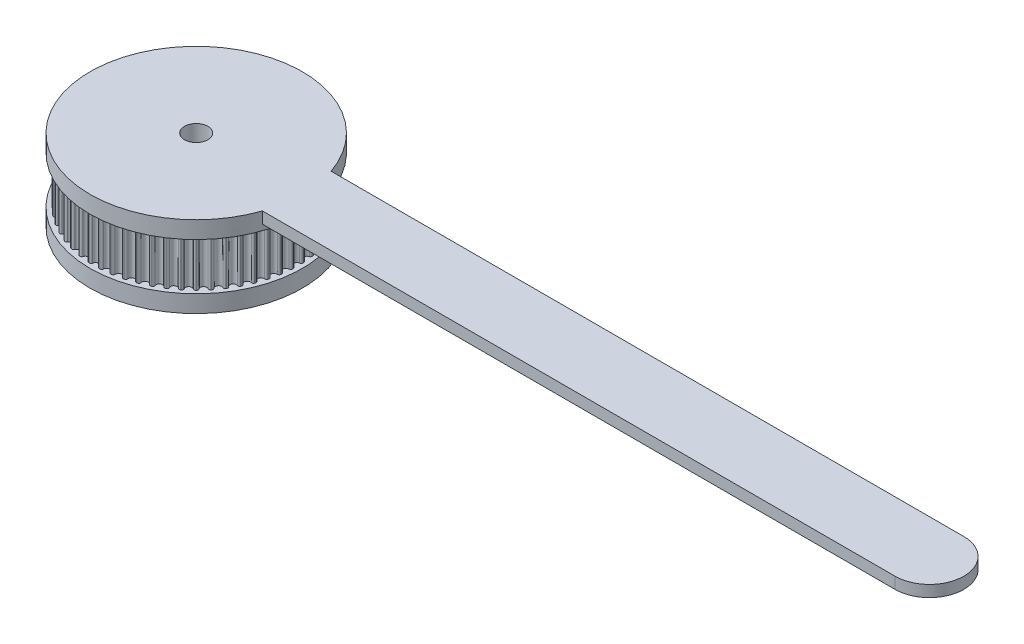
from build123d import *
from build123d.topology import SkipClean

# Parameters (mm, degrees)
BOSS_EXTRUDE1_DEPTH     = 6.499999954
CIRPATTERN1_COUNT       = 60
SKETCH2_W               = 29.441486473
SKETCH2_H               = 1.5875
BOSS_EXTRUDE4_DEPTH     = 3.175
BOSS_EXTRUDE5_START     = 3.175
SKETCH8_R               = 29.441486473
BOSS_EXTRUDE5_DEPTH     = 3.175
CUT_EXTRUDE1_DEPTH      = 216.930781436
CUT_EXTRUDE1_DEPTH_BACK = 216.930781436
SKETCH9_R               = 3.2385


with BuildPart() as part:
    # Sketch1 → Boss-Extrude1 (new, symmetric)
    with BuildSketch(Plane(origin=(0, 0, 0), x_dir=(1, 0, 0), z_dir=(0, 1, 0))):
        with BuildLine():
            ThreePointArc((0, 27.046736373), (0.58129755, 27.262797831), (0.880356905, 27.806077591))
            ThreePointArc((0.880356905, 27.806077591), (1.057844919, 28.119262803), (1.399698205, 28.232060424))
            ThreePointArc((1.399698205, 28.232060424), (1.479366683, 28.227997893), (1.55902338, 28.223710545))
            ThreePointArc((1.55902338, 28.223710545), (1.887213395, 28.075797443), (2.030992343, 27.745775343))
            ThreePointArc((2.030992343, 27.745775343), (2.271625221, 27.174211512), (2.827153789, 26.898571521))
            ThreePointArc((2.827153789, 26.898571521), (-1.415516811, -27.009669761), (0, 27.046736373))
        make_face()
    boss_extrude1 = extrude(amount=BOSS_EXTRUDE1_DEPTH, both=True)

    # CirPattern1: Boss-Extrude1 ×60 about axis
    cirpattern1_axis = Axis((0, 0, 0), (0, 1, 0))
    for i in range(1, CIRPATTERN1_COUNT):
        add(boss_extrude1.rotate(cirpattern1_axis, i * 360 / CIRPATTERN1_COUNT))

    # Sketch2 → Revolve3 (revolve)
    with BuildSketch(Plane(origin=(0, 0, 0), x_dir=(0, 0, -1), z_dir=(1, 0, 0)), mode=Mode.PRIVATE) as revolve3_sk:
        with Locations((14.720743237, 7.293749954)):
            Rectangle(SKETCH2_W, SKETCH2_H)
    revolve3 = revolve(revolve3_sk.sketch.rotate(Axis((0, 3.3, 0), (0, -1, 0)), 180), axis=Axis((0, 3.3, 0), (0, -1, 0)))

    # Mirror1: Revolve3 across plane
    add(revolve3.mirror(Plane.ZX))

    # Sketch7 → Boss-Extrude4 (add)
    with SkipClean():  # the faces are left unmerged after this step: merging them gives an invalid solid
        with BuildSketch(Plane(origin=(0, 8.087499954, 0), x_dir=(1, 0, 0), z_dir=(0, 1, 0))):
            with BuildLine():
                Line((27.858131681, 9.525), (203.2, 9.525))
                ThreePointArc((203.2, 9.525), (212.725, 0), (203.2, -9.525))
                Line((203.2, -9.525), (27.858131681, -9.525))
                ThreePointArc((27.858131681, -9.525), (-29.441486473, 0), (27.858131681, 9.525))
            make_face()
        extrude(amount=BOSS_EXTRUDE4_DEPTH)

    # Sketch8 → Boss-Extrude5 (add)
    with SkipClean():  # the faces are left unmerged after this step: merging them gives an invalid solid
        with BuildSketch(Plane.XZ.offset(8.087499954).offset(BOSS_EXTRUDE5_START)):
            with Locations(Location((0, 0, 0), (0, 0, 90))):
                Circle(SKETCH8_R)
        extrude(amount=-BOSS_EXTRUDE5_DEPTH)

    # Sketch9 → Cut-Extrude1 (cut, two sides: drawn at the far end of the back side and taken through both)
    with SkipClean():  # the faces are left unmerged after this step: merging them gives an invalid solid
        with BuildSketch(Plane.XZ.offset(11.262499954).offset(-CUT_EXTRUDE1_DEPTH_BACK)):
            with Locations(Location((0, 0, 0), (0, 0, 270))):
                Circle(SKETCH9_R)
        extrude(amount=CUT_EXTRUDE1_DEPTH + CUT_EXTRUDE1_DEPTH_BACK, mode=Mode.SUBTRACT)


solid = part.part
